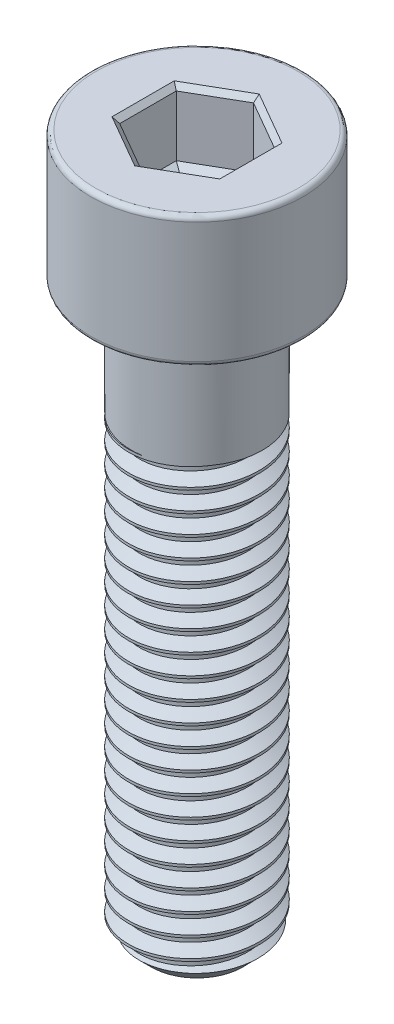
from build123d import *

# Parameters (mm, degrees)
SKETCH1_R           = 4
BOSS_EXTRUDE1_DEPTH = 28
THREAD1_PITCH       = 1.25
SKETCH2_R           = 4
BOSS_EXTRUDE2_DEPTH = 7
SKETCH5_R           = 6.5
BOSS_EXTRUDE3_DEPTH = 8
FILLET1_R           = 0.3
CUT_EXTRUDE1_DEPTH  = 4
CHAMFER1_SIZE       = 0.3
CUT_EXTRUDE2_DEPTH  = 0.4
CUT_EXTRUDE2_DRAFT  = -60


with BuildPart() as part:
    # Sketch1 → Boss-Extrude1 (new body)
    with BuildSketch(Plane(origin=(0, 0, 0), x_dir=(1, 0, 0), z_dir=(0, 1, 0))):
        with Locations(Location((0, 0, 0), (0, 0, 270))):
            Circle(SKETCH1_R)
    extrude(amount=BOSS_EXTRUDE1_DEPTH)

    # Thread1: the profile of Thread Profile1 profile screwed along a right-hand helix of 24 turns, 8 arcs to a turn; built about Z, then put on its axis
    thread1_z = Axis((0, 0, 0), (0, 0, 1))
    thread1_corners = [(4.0003, 0, -0.000173205), (4.0003, 0, 1.093923202), (3.323417656, 0, 0.703124998), (3.323417656, 0, 0.390624998)]
    with BuildLine(mode=Mode.PRIVATE) as thread1_profile:
        Line(thread1_corners[0], thread1_corners[1])
        Line(thread1_corners[1], thread1_corners[2])
        Line(thread1_corners[2], thread1_corners[3])
        Line(thread1_corners[3], thread1_corners[0])
    thread1_cap = Face(thread1_profile.wire())
    thread1_turn_angles = [0, 22.5, 45, 67.5, 90, 112.5, 135, 157.5, 180, 202.5, 225, 247.5, 270, 292.5, 315, 337.5, 360]
    thread1_turn_weights = [1, 0.9238795325112867, 1, 0.9238795325112867, 1, 0.9238795325112867, 1, 0.9238795325112867, 1, 0.9238795325112867, 1, 0.9238795325112867, 1, 0.9238795325112867, 1, 0.9238795325112867, 1]
    thread1_turn_rails = [Edge.make_bspline([Vector(p[0], p[1], 0).rotate(thread1_z, thread1_turn_angles[k]) / thread1_turn_weights[k] + Vector(0, 0, p[2] + THREAD1_PITCH * thread1_turn_angles[k] / 360) for k in range(17)], [0, 0, 0, 1, 1, 2, 2, 3, 3, 4, 4, 5, 5, 6, 6, 7, 7, 8, 8, 8], 2, thread1_turn_weights) for p in thread1_corners]
    thread1_turn_sides = [Face.make_surface_from_curves(thread1_turn_rails[p[0]], thread1_turn_rails[p[1]]) for p in [(0, 1), (1, 2), (2, 3), (3, 0)]]
    thread1 = Plane(origin=(0, 30, 0), x_dir=(-1, 0, 0), z_dir=(0, -1, 0)) * Solid(Shell([*[p.moved(Location((0, 0, THREAD1_PITCH * i))) for i in range(24) for p in thread1_turn_sides], thread1_cap, thread1_cap.rotate(thread1_z, 8640).moved(Location((0, 0, THREAD1_PITCH * 8640 / 360)))]))
    add(thread1, mode=Mode.SUBTRACT)

    # Sketch2 → Boss-Extrude2 (add)
    with BuildSketch(Plane(origin=(0, 28, 0), x_dir=(1, 0, 0), z_dir=(0, 1, 0))):
        with Locations(Location((0, 0, 0), (0, 0, 117.593571361))):
            Circle(SKETCH2_R)
    extrude(amount=BOSS_EXTRUDE2_DEPTH)

    # Sketch5 → Boss-Extrude3 (add)
    with BuildSketch(Plane(origin=(0, 35, 0), x_dir=(1, 0, 0), z_dir=(0, 1, 0))):
        with Locations(Location((0, 0, 0), (0, 0, 270))):
            Circle(SKETCH5_R)
    extrude(amount=BOSS_EXTRUDE3_DEPTH)

    # Sketch6 → Cut-Revolve1 (revolve, cut)
    with BuildSketch(Plane.XY, mode=Mode.PRIVATE) as cut_revolve1_sk:
        Polygon((4.01, 0), (4.01, 1.2), (2.81, 0), align=None)
    revolve(cut_revolve1_sk.sketch.rotate(Axis((0, 0, 0), (0, 1, 0)), 117.593571361), axis=Axis((0, 0, 0), (0, 1, 0)), mode=Mode.SUBTRACT)

    # Fillet1
    fillet1_edges = [part.edges().sort_by_distance(p)[0] for p in [
        (0, 35, -6.5),
        (0, 43, -6.5),
    ]]
    fillet(fillet1_edges, radius=FILLET1_R)

    # Sketch7 → Cut-Extrude1 (cut)
    with BuildSketch(Plane(origin=(0, 43, 0), x_dir=(1, 0, 0), z_dir=(0, 1, 0))):
        Polygon((0, 3.464101615), (-3, 1.732050808), (-3, -1.732050808), (0, -3.464101615), (3, -1.732050808), (3, 1.732050808), align=None)
    extrude(amount=-CUT_EXTRUDE1_DEPTH, mode=Mode.SUBTRACT)

    # Chamfer1
    chamfer1_edges = [part.edges().sort_by_distance(p)[0] for p in [
        (1.5, 43, -2.598076211),
        (-1.5, 43, -2.598076211),
        (-3, 43, 0),
        (-1.5, 43, 2.598076211),
        (1.5, 43, 2.598076211),
        (3, 43, 0),
    ]]
    chamfer(chamfer1_edges, length=CHAMFER1_SIZE)


with BuildPart() as cut_extrude2_tool:
    # Sketch8 → Cut-Extrude2 (with draft: the straight prism first)
    with BuildSketch(Plane(origin=(0, 39, 0), x_dir=(1, 0, 0), z_dir=(0, 1, 0))):
        Polygon((0, 3.464101615), (-3, 1.732050808), (-3, -1.732050808), (0, -3.464101615), (3, -1.732050808), (3, 1.732050808), align=None)
    extrude(amount=-CUT_EXTRUDE2_DEPTH)
    # Cut-Extrude2: the draft: its side faces are tilted about the plane it starts from
    cut_extrude2_sides = [cut_extrude2_tool.faces().sort_by_distance(p)[0] for p in [
        (-1.5, 38.8, -2.598076211),
        (-3, 38.8, 0),
        (-1.5, 38.8, 2.598076211),
        (1.5, 38.8, 2.598076211),
        (3, 38.8, 0),
        (1.5, 38.8, -2.598076211),
    ]]
    draft(cut_extrude2_sides, Plane(origin=(0, 39, 0), x_dir=(1, 0, 0), z_dir=(0, 1, 0)), CUT_EXTRUDE2_DRAFT)


with BuildPart() as part_1:
    add(part.part)

    # Cut-Extrude2: cut by cut_extrude2_tool
    add(cut_extrude2_tool.part, mode=Mode.SUBTRACT)


solid = part_1.part
